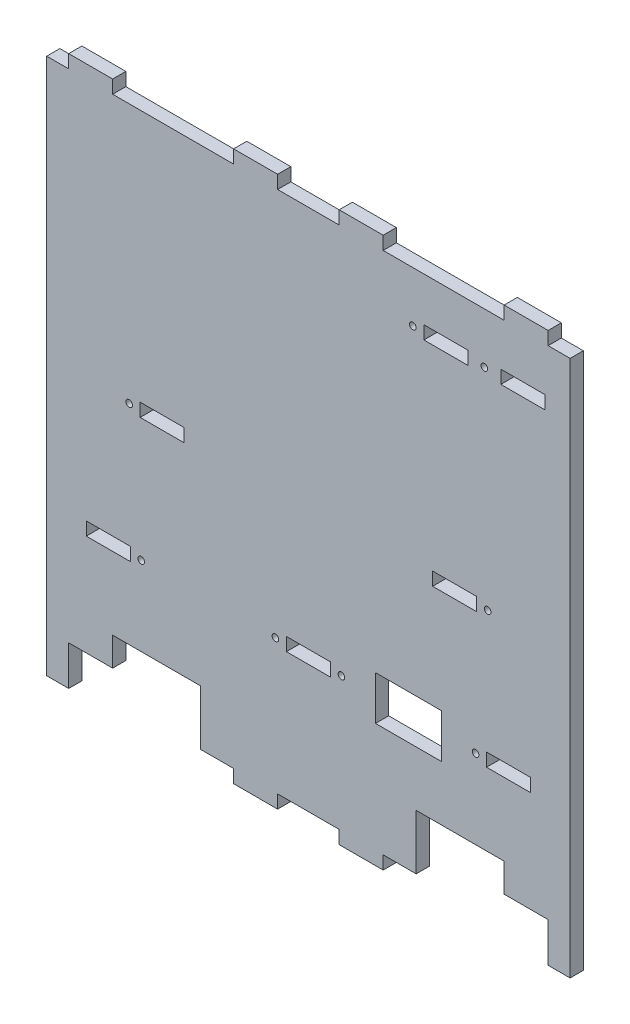
from build123d import *

# Parameters (mm, degrees)
ESQUISSE1_W             = 218
ESQUISSE1_H             = 238
ESQUISSE1_W_2           = 20
ESQUISSE1_H_2           = 6
ESQUISSE1_W_3           = 30
ESQUISSE1_H_3           = 20
BOSS_EXTRU_1_DEPTH      = 6
ESQUISSE2_W             = 40
ESQUISSE2_H             = 25
ENL_V_MAT_EXTRU_1_DEPTH = 6
ESQUISSE3_W             = 20
ESQUISSE3_H             = 6
BOSS_EXTRU_3_DEPTH      = 6
ESQUISSE4_R             = 1.5
ENL_V_MAT_EXTRU_2_DEPTH = 6
ESQUISSE5_W             = 10
ESQUISSE5_H             = 244
BOSS_EXTRU_4_DEPTH      = 6
ESQUISSE6_W             = 20
ESQUISSE6_H             = 12
ENL_V_MAT_EXTRU_3_DEPTH = 6


with BuildPart() as part:
    # Esquisse1 → Boss.-Extru.1 (new body)
    with BuildSketch(Plane.XY):
        Rectangle(ESQUISSE1_W, ESQUISSE1_H)
        with Locations((-91, -58)):
            Rectangle(ESQUISSE1_W_2, ESQUISSE1_H_2, mode=Mode.SUBTRACT)
        with Locations((0, -58)):
            Rectangle(ESQUISSE1_W_2, ESQUISSE1_H_2, mode=Mode.SUBTRACT)
        with Locations((91, -58)):
            Rectangle(ESQUISSE1_W_2, ESQUISSE1_H_2, mode=Mode.SUBTRACT)
        with Locations((-66.5, 1)):
            Rectangle(ESQUISSE1_W_2, ESQUISSE1_H_2, mode=Mode.SUBTRACT)
        with Locations((66.5, 1)):
            Rectangle(ESQUISSE1_W_2, ESQUISSE1_H_2, mode=Mode.SUBTRACT)
        with Locations((45.5, -59)):
            Rectangle(ESQUISSE1_W_3, ESQUISSE1_H_3, mode=Mode.SUBTRACT)
        with Locations((62.5, 96)):
            Rectangle(ESQUISSE1_W_2, ESQUISSE1_H_2, mode=Mode.SUBTRACT)
        with Locations((97.5, 96)):
            Rectangle(ESQUISSE1_W_2, ESQUISSE1_H_2, mode=Mode.SUBTRACT)
    extrude(amount=BOSS_EXTRU_1_DEPTH)

    # Esquisse2 → Enlèv. mat.-Extru.1 (cut)
    with BuildSketch(Plane.XY.offset(6)):
        with Locations((-69, -106.5)):
            Rectangle(ESQUISSE2_W, ESQUISSE2_H)
        with Locations((69, -106.5)):
            Rectangle(ESQUISSE2_W, ESQUISSE2_H)
    extrude(amount=-ENL_V_MAT_EXTRU_1_DEPTH, mode=Mode.SUBTRACT)

    # Esquisse3 → Boss.-Extru.3 (add)
    with BuildSketch(Plane.XY.offset(6)):
        with Locations((-24, -122)):
            Rectangle(ESQUISSE3_W, ESQUISSE3_H)
        with Locations((24, -122)):
            Rectangle(ESQUISSE3_W, ESQUISSE3_H)
        with Locations((24, 122)):
            Rectangle(ESQUISSE3_W, ESQUISSE3_H)
        with Locations((99, 122)):
            Rectangle(ESQUISSE3_W, ESQUISSE3_H)
        with Locations((-24, 122)):
            Rectangle(ESQUISSE3_W, ESQUISSE3_H)
        with Locations((-99, 122)):
            Rectangle(ESQUISSE3_W, ESQUISSE3_H)
    extrude(amount=-BOSS_EXTRU_3_DEPTH)

    # Esquisse4 → Enlèv. mat.-Extru.2 (cut)
    with BuildSketch(Plane.XY.offset(6)):
        with Locations((-15, -58)):
            Circle(ESQUISSE4_R)
        with Locations((-76, -58)):
            Circle(ESQUISSE4_R)
        with Locations((80, 96)):
            Circle(ESQUISSE4_R)
        with Locations((81.5, 1)):
            Circle(ESQUISSE4_R)
        with Locations((76, -58)):
            Circle(ESQUISSE4_R)
        with Locations((15, -58)):
            Circle(ESQUISSE4_R)
        with Locations((-81.5, 1)):
            Circle(ESQUISSE4_R)
        with Locations((47.5, 96)):
            Circle(ESQUISSE4_R)
    extrude(amount=-ENL_V_MAT_EXTRU_2_DEPTH, mode=Mode.SUBTRACT)

    # Esquisse5 → Boss.-Extru.4 (add)
    with BuildSketch(Plane.XY.offset(6)):
        with Locations((-114, -3)):
            Rectangle(ESQUISSE5_W, ESQUISSE5_H)
        with Locations((114, -3)):
            Rectangle(ESQUISSE5_W, ESQUISSE5_H)
    extrude(amount=-BOSS_EXTRU_4_DEPTH)

    # Esquisse6 → Enlèv. mat.-Extru.3 (cut)
    with BuildSketch(Plane.XY.offset(6)):
        with Locations((99, -113)):
            Rectangle(ESQUISSE6_W, ESQUISSE6_H)
        with Locations((-99, -113)):
            Rectangle(ESQUISSE6_W, ESQUISSE6_H)
    extrude(amount=-ENL_V_MAT_EXTRU_3_DEPTH, mode=Mode.SUBTRACT)


solid = part.part
